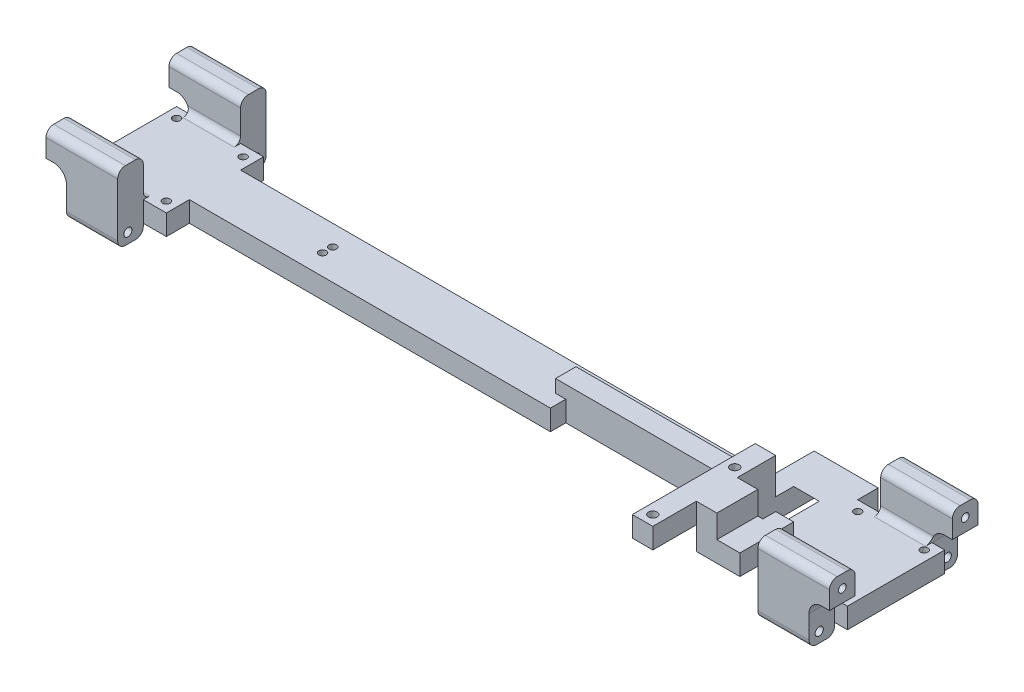
from build123d import *

# Parameters (mm, degrees)
SKETCH1_W                 = 300
SKETCH1_H                 = 20
BOSS_EXTRUDE1_DEPTH       = 8
SKETCH2_W                 = 34
SKETCH2_H                 = 8
BOSS_EXTRUDE2_DEPTH       = 9
SKETCH3_W                 = 34
SKETCH3_H                 = 8
BOSS_EXTRUDE3_DEPTH       = 9
SKETCH4_R                 = 1.45
CUT_EXTRUDE1_DEPTH        = 302.504560496
SKETCH5_W                 = 25
SKETCH5_H                 = 8
BOSS_EXTRUDE4_DEPTH       = 17
SKETCH6_W                 = 25
SKETCH6_H                 = 8
BOSS_EXTRUDE5_DEPTH       = 17
SKETCH12_W                = 8
SKETCH12_H                = 8
BOSS_EXTRUDE7_DEPTH       = 17
SKETCH14_W                = 20
SKETCH14_H                = 12
BOSS_EXTRUDE8_DEPTH       = 10
SKETCH15_R                = 1.6
CUT_EXTRUDE7_DEPTH        = 20
SKETCH16_W                = 20
SKETCH16_H                = 12
BOSS_EXTRUDE9_DEPTH       = 10
SKETCH17_R                = 1.6
CUT_EXTRUDE8_DEPTH        = 20
SKETCH18_W                = 20
SKETCH18_H                = 12
BOSS_EXTRUDE10_DEPTH      = 10
CUT_EXTRUDE9_START        = -20
SKETCH19_R                = 1.6
CUT_EXTRUDE9_DEPTH        = 20
SKETCH20_W                = 20
SKETCH20_H                = 12
BOSS_EXTRUDE11_DEPTH      = 10
CUT_EXTRUDE10_START       = -20
SKETCH21_R                = 1.6
CUT_EXTRUDE10_DEPTH       = 20
SKETCH22_W                = 10
SKETCH22_H                = 38
CUT_EXTRUDE11_DEPTH       = 306.057371653
SKETCH23_W                = 8
SKETCH23_H                = 18
CUT_EXTRUDE12_DEPTH       = 4
BOSS_EXTRUDE12_DEPTH      = 10
BOSS_EXTRUDE13_DEPTH      = 8
SKETCH26_W                = 8
SKETCH26_H                = 48
BOSS_EXTRUDE14_DEPTH      = 14
SKETCH27_W                = 8
SKETCH27_H                = 16
BOSS_EXTRUDE15_DEPTH      = 14
SKETCH28_W                = 8
SKETCH28_H                = 40
CUT_EXTRUDE13_DEPTH       = 14
SKETCH30_W                = 16
SKETCH30_H                = 14
BOSS_EXTRUDE16_DEPTH      = 9
SKETCH31_W                = 17
SKETCH31_H                = 8
CUT_EXTRUDE14_DEPTH       = 5
SKETCH32_W                = 16
SKETCH32_H                = 9
CUT_EXTRUDE15_DEPTH       = 9
CUT_EXTRUDE16_DEPTH       = 10
SKETCH34_W                = 7
SKETCH34_H                = 5
CUT_EXTRUDE17_DEPTH       = 5
SKETCH35_W                = 7
SKETCH35_H                = 5
BOSS_EXTRUDE17_DEPTH      = 5
SKETCH36_R                = 1.7
CUT_EXTRUDE18_DEPTH       = 306.928096127
SKETCH37_W                = 70
SKETCH37_H                = 8
BOSS_EXTRUDE18_DEPTH      = 5
SKETCH39_W                = 66
SKETCH39_H                = 6
CUT_EXTRUDE19_DEPTH       = 306.14258962
SKETCH40_W                = 20
SKETCH40_H                = 10
BOSS_EXTRUDE19_DEPTH      = 10
BOSS_EXTRUDE20_DEPTH      = 5
BOSS_EXTRUDE20_DEPTH_BACK = 5
SKETCH41_W                = 28
SKETCH41_H                = 10
SKETCH42_R                = 1.5
CUT_EXTRUDE20_DEPTH       = 15
SKETCH43_W                = 20
SKETCH43_H                = 10
BOSS_EXTRUDE21_DEPTH      = 10
BOSS_EXTRUDE22_DEPTH      = 5
BOSS_EXTRUDE22_DEPTH_BACK = 5
SKETCH44_W                = 28
SKETCH44_H                = 10
SKETCH45_R                = 1.5
CUT_EXTRUDE21_DEPTH       = 15
SKETCH46_W                = 20
SKETCH46_H                = 10
BOSS_EXTRUDE23_DEPTH      = 10
BOSS_EXTRUDE24_DEPTH      = 5
BOSS_EXTRUDE24_DEPTH_BACK = 5
SKETCH47_W                = 28
SKETCH47_H                = 10
CUT_EXTRUDE22_START       = -15
SKETCH48_R                = 1.5
CUT_EXTRUDE22_DEPTH       = 15
FILLET1_R                 = 5
FILLET2_R                 = 2.5
FILLET3_R                 = 3
FILLET4_R                 = 3
SKETCH49_R                = 1.45
CUT_EXTRUDE23_DEPTH       = 309.139578763


with BuildPart() as part:
    # Sketch1 → Boss-Extrude1 (new body)
    with BuildSketch(Plane(origin=(0, 0, 0), x_dir=(1, 0, 0), z_dir=(0, 1, 0))):
        with Locations((150, -10)):
            Rectangle(SKETCH1_W, SKETCH1_H)
    extrude(amount=BOSS_EXTRUDE1_DEPTH)

    # Sketch2 → Boss-Extrude2 (add)
    with BuildSketch(Plane.XY.offset(20)):
        with Locations((17, 4)):
            Rectangle(SKETCH2_W, SKETCH2_H)
        with Locations((283, 4)):
            Rectangle(SKETCH2_W, SKETCH2_H)
    extrude(amount=BOSS_EXTRUDE2_DEPTH)

    # Sketch3 → Boss-Extrude3 (add)
    with BuildSketch(Plane(origin=(0, 0, 0), x_dir=(-1, 0, 0), z_dir=(0, 0, -1))):
        with Locations((-17, 4)):
            Rectangle(SKETCH3_W, SKETCH3_H)
        with Locations((-283, 4)):
            Rectangle(SKETCH3_W, SKETCH3_H)
    extrude(amount=BOSS_EXTRUDE3_DEPTH)

    # Sketch4 → Cut-Extrude1 (cut, through all)
    with BuildSketch(Plane(origin=(0, 8, 0), x_dir=(1, 0, 0), z_dir=(0, 1, 0))):
        with Locations(Location((4, 5, 0), (0, 0, 270))):
            Circle(SKETCH4_R)
        with Locations(Location((30, 5, 0), (0, 0, 270))):
            Circle(SKETCH4_R)
        with Locations(Location((30, -25, 0), (0, 0, 270))):
            Circle(SKETCH4_R)
        with Locations(Location((4, -25, 0), (0, 0, 270))):
            Circle(SKETCH4_R)
        with Locations(Location((296, -25, 0), (0, 0, 270))):
            Circle(SKETCH4_R)
        with Locations(Location((296, 5, 0), (0, 0, 270))):
            Circle(SKETCH4_R)
        with Locations(Location((270, -25, 0), (0, 0, 270))):
            Circle(SKETCH4_R)
        with Locations(Location((270, 5, 0), (0, 0, 270))):
            Circle(SKETCH4_R)
    extrude(amount=-CUT_EXTRUDE1_DEPTH, mode=Mode.SUBTRACT)

    # Sketch5 → Boss-Extrude4 (add)
    with BuildSketch(Plane.XY.offset(20)):
        with Locations((253.5, 4)):
            Rectangle(SKETCH5_W, SKETCH5_H)
    extrude(amount=BOSS_EXTRUDE4_DEPTH)

    # Sketch6 → Boss-Extrude5 (add)
    with BuildSketch(Plane(origin=(0, 0, 0), x_dir=(-1, 0, 0), z_dir=(0, 0, -1))):
        with Locations((-253.5, 4)):
            Rectangle(SKETCH6_W, SKETCH6_H)
    extrude(amount=BOSS_EXTRUDE5_DEPTH)

    # Sketch12 → Boss-Extrude7 (add)
    with BuildSketch(Plane.XY.offset(37)):
        with Locations((245, 4)):
            Rectangle(SKETCH12_W, SKETCH12_H)
    extrude(amount=BOSS_EXTRUDE7_DEPTH)

    # Sketch14 → Boss-Extrude8 (add)
    with BuildSketch(Plane.XY.offset(29)):
        with Locations((285, 2)):
            Rectangle(SKETCH14_W, SKETCH14_H)
    extrude(amount=BOSS_EXTRUDE8_DEPTH)

    # Sketch15 → Cut-Extrude7 (cut)
    with BuildSketch(Plane(origin=(295, 0, 0), x_dir=(0, 0, -1), z_dir=(1, 0, 0))):
        with Locations((-35, 0)):
            Circle(SKETCH15_R)
    extrude(amount=-CUT_EXTRUDE7_DEPTH, mode=Mode.SUBTRACT)

    # Sketch16 → Boss-Extrude9 (add)
    with BuildSketch(Plane(origin=(0, 0, -9), x_dir=(-1, 0, 0), z_dir=(0, 0, -1))):
        with Locations((-285, 2)):
            Rectangle(SKETCH16_W, SKETCH16_H)
    extrude(amount=BOSS_EXTRUDE9_DEPTH)

    # Sketch17 → Cut-Extrude8 (cut)
    with BuildSketch(Plane(origin=(295, 0, 0), x_dir=(0, 0, -1), z_dir=(1, 0, 0))):
        with Locations((15, 0)):
            Circle(SKETCH17_R)
    extrude(amount=-CUT_EXTRUDE8_DEPTH, mode=Mode.SUBTRACT)

    # Sketch18 → Boss-Extrude10 (add)
    with BuildSketch(Plane(origin=(0, 0, -9), x_dir=(-1, 0, 0), z_dir=(0, 0, -1))):
        with Locations((-15, 2)):
            Rectangle(SKETCH18_W, SKETCH18_H)
    extrude(amount=BOSS_EXTRUDE10_DEPTH)

    # Sketch19 → Cut-Extrude9 (cut)
    with BuildSketch(Plane.ZY.offset(-5).offset(CUT_EXTRUDE9_START)):
        with Locations(Location((-15, 0, 0), (0, 0, 180))):
            Circle(SKETCH19_R)
    extrude(amount=CUT_EXTRUDE9_DEPTH, mode=Mode.SUBTRACT)

    # Sketch20 → Boss-Extrude11 (add)
    with BuildSketch(Plane.XY.offset(29)):
        with Locations((15, 2)):
            Rectangle(SKETCH20_W, SKETCH20_H)
    extrude(amount=BOSS_EXTRUDE11_DEPTH)

    # Sketch21 → Cut-Extrude10 (cut)
    with BuildSketch(Plane.ZY.offset(-5).offset(CUT_EXTRUDE10_START)):
        with Locations(Location((35, 0, 0), (0, 0, 180))):
            Circle(SKETCH21_R)
    extrude(amount=CUT_EXTRUDE10_DEPTH, mode=Mode.SUBTRACT)

    # Sketch22 → Cut-Extrude11 (cut, through all)
    with BuildSketch(Plane(origin=(0, 8, 0), x_dir=(1, 0, 0), z_dir=(0, 1, 0))):
        with Locations((254, -10)):
            Rectangle(SKETCH22_W, SKETCH22_H)
    extrude(amount=-CUT_EXTRUDE11_DEPTH, mode=Mode.SUBTRACT)

    # Sketch23 → Cut-Extrude12 (cut)
    with BuildSketch(Plane(origin=(0, 0, 0), x_dir=(-1, 0, 0), z_dir=(0, -1, 0))):
        with Locations((-263, -10)):
            Rectangle(SKETCH23_W, SKETCH23_H)
    extrude(amount=-CUT_EXTRUDE12_DEPTH, mode=Mode.SUBTRACT)

    # Sketch24 → Boss-Extrude12 (add)
    with BuildSketch(Plane.ZY.offset(-259)):
        Polygon((-9, 0), (-9, 8), (-1, 8), align=None)
        Polygon((29, 0), (29, 8), (21, 8), align=None)
    extrude(amount=BOSS_EXTRUDE12_DEPTH)

    # Sketch25 → Boss-Extrude13 (add)
    with BuildSketch(Plane.ZY.offset(-267)):
        Polygon((19, 0), (19, 4), (15, 4), align=None)
        Polygon((1, 4), (5, 4), (1, 0), align=None)
    extrude(amount=BOSS_EXTRUDE13_DEPTH)

    # Sketch26 → Boss-Extrude14 (add)
    with BuildSketch(Plane(origin=(0, 8, 0), x_dir=(1, 0, 0), z_dir=(0, 1, 0))):
        with Locations((245, -30)):
            Rectangle(SKETCH26_W, SKETCH26_H)
    extrude(amount=BOSS_EXTRUDE14_DEPTH)

    # Sketch27 → Boss-Extrude15 (add)
    with BuildSketch(Plane(origin=(0, 8, 0), x_dir=(1, 0, 0), z_dir=(0, 1, 0))):
        with Locations((253, -29)):
            Rectangle(SKETCH27_W, SKETCH27_H)
    extrude(amount=BOSS_EXTRUDE15_DEPTH)

    # Sketch28 → Cut-Extrude13 (cut)
    with BuildSketch(Plane.XZ):
        with Locations((245, 34)):
            Rectangle(SKETCH28_W, SKETCH28_H)
    extrude(amount=-CUT_EXTRUDE13_DEPTH, mode=Mode.SUBTRACT)

    # Sketch30 → Boss-Extrude16 (add)
    with BuildSketch(Plane(origin=(257, 0, 0), x_dir=(0, 0, -1), z_dir=(1, 0, 0))):
        with Locations((-29, 15)):
            Rectangle(SKETCH30_W, SKETCH30_H)
    extrude(amount=BOSS_EXTRUDE16_DEPTH)

    # Sketch31 → Cut-Extrude14 (cut)
    with BuildSketch(Plane(origin=(0, 0, 0), x_dir=(-1, 0, 0), z_dir=(0, -1, 0))):
        with Locations((-257.5, -33)):
            Rectangle(SKETCH31_W, SKETCH31_H)
    extrude(amount=-CUT_EXTRUDE14_DEPTH, mode=Mode.SUBTRACT)

    # Sketch32 → Cut-Extrude15 (cut)
    with BuildSketch(Plane(origin=(266, 0, 0), x_dir=(0, 0, -1), z_dir=(1, 0, 0))):
        with Locations((-29, 17.5)):
            Rectangle(SKETCH32_W, SKETCH32_H)
    extrude(amount=-CUT_EXTRUDE15_DEPTH, mode=Mode.SUBTRACT)

    # Sketch33 → Cut-Extrude16 (cut)
    with BuildSketch(Plane.ZY.offset(-249)):
        Polygon((29, 5), (24, 5), (29, 0), align=None)
    extrude(amount=-CUT_EXTRUDE16_DEPTH, mode=Mode.SUBTRACT)

    # Sketch34 → Cut-Extrude17 (cut)
    with BuildSketch(Plane.XY.offset(29)):
        with Locations((262.5, 2.5)):
            Rectangle(SKETCH34_W, SKETCH34_H)
    extrude(amount=-CUT_EXTRUDE17_DEPTH, mode=Mode.SUBTRACT)

    # Sketch35 → Boss-Extrude17 (add)
    with BuildSketch(Plane(origin=(0, 0, 21), x_dir=(-1, 0, 0), z_dir=(0, 0, -1))):
        with Locations((-262.5, 10.5)):
            Rectangle(SKETCH35_W, SKETCH35_H)
    extrude(amount=BOSS_EXTRUDE17_DEPTH)

    # Sketch36 → Cut-Extrude18 (cut, through all)
    with BuildSketch(Plane(origin=(0, 22, 0), x_dir=(1, 0, 0), z_dir=(0, 1, 0))):
        with Locations(Location((245, -50, 0), (0, 0, 270))):
            Circle(SKETCH36_R)
        with Locations(Location((245, -18, 0), (0, 0, 270))):
            Circle(SKETCH36_R)
    extrude(amount=-CUT_EXTRUDE18_DEPTH, mode=Mode.SUBTRACT)

    # Sketch37 → Boss-Extrude18 (add)
    with BuildSketch(Plane(origin=(0, 8, 0), x_dir=(1, 0, 0), z_dir=(0, 1, 0))):
        with Locations((206, -10)):
            Rectangle(SKETCH37_W, SKETCH37_H)
    extrude(amount=BOSS_EXTRUDE18_DEPTH)

    # Sketch39 → Cut-Extrude19 (cut, through all)
    with BuildSketch(Plane(origin=(0, 8, 0), x_dir=(1, 0, 0), z_dir=(0, 1, 0))):
        with Locations((208, -17)):
            Rectangle(SKETCH39_W, SKETCH39_H)
    extrude(amount=-CUT_EXTRUDE19_DEPTH, mode=Mode.SUBTRACT)

    # Sketch40 → Boss-Extrude19 (add)
    with BuildSketch(Plane(origin=(0, 8, 0), x_dir=(1, 0, 0), z_dir=(0, 1, 0))):
        with Locations((15, 14)):
            Rectangle(SKETCH40_W, SKETCH40_H)
    extrude(amount=BOSS_EXTRUDE19_DEPTH)

    # Sketch41 → Boss-Extrude20 (add, two sides: drawn at the far end of the back side and taken through both)
    with BuildSketch(Plane(origin=(0, 18, 0), x_dir=(1, 0, 0), z_dir=(0, 1, 0)).offset(-BOSS_EXTRUDE20_DEPTH_BACK)):
        with Locations((11, 14)):
            Rectangle(SKETCH41_W, SKETCH41_H)
    extrude(amount=BOSS_EXTRUDE20_DEPTH + BOSS_EXTRUDE20_DEPTH_BACK)

    # Sketch42 → Cut-Extrude20 (cut)
    with BuildSketch(Plane.ZY.offset(3)):
        with Locations((-14, 18)):
            Circle(SKETCH42_R)
    extrude(amount=-CUT_EXTRUDE20_DEPTH, mode=Mode.SUBTRACT)

    # Sketch43 → Boss-Extrude21 (add)
    with BuildSketch(Plane(origin=(0, 8, 0), x_dir=(1, 0, 0), z_dir=(0, 1, 0))):
        with Locations((15, -34)):
            Rectangle(SKETCH43_W, SKETCH43_H)
    extrude(amount=BOSS_EXTRUDE21_DEPTH)

    # Sketch44 → Boss-Extrude22 (add, two sides: drawn at the far end of the back side and taken through both)
    with BuildSketch(Plane(origin=(0, 18, 0), x_dir=(1, 0, 0), z_dir=(0, 1, 0)).offset(-BOSS_EXTRUDE22_DEPTH_BACK)):
        with Locations((11, -34)):
            Rectangle(SKETCH44_W, SKETCH44_H)
    extrude(amount=BOSS_EXTRUDE22_DEPTH + BOSS_EXTRUDE22_DEPTH_BACK)

    # Sketch45 → Cut-Extrude21 (cut)
    with BuildSketch(Plane.ZY.offset(3)):
        with Locations((34, 18)):
            Circle(SKETCH45_R)
    extrude(amount=-CUT_EXTRUDE21_DEPTH, mode=Mode.SUBTRACT)

    # Sketch46 → Boss-Extrude23 (add)
    with BuildSketch(Plane(origin=(0, 8, 0), x_dir=(1, 0, 0), z_dir=(0, 1, 0))):
        with Locations((285, 14)):
            Rectangle(SKETCH46_W, SKETCH46_H)
        with Locations((285, -34)):
            Rectangle(SKETCH46_W, SKETCH46_H)
    extrude(amount=BOSS_EXTRUDE23_DEPTH)

    # Sketch47 → Boss-Extrude24 (add, two sides: drawn at the far end of the back side and taken through both)
    with BuildSketch(Plane(origin=(0, 18, 0), x_dir=(1, 0, 0), z_dir=(0, 1, 0)).offset(-BOSS_EXTRUDE24_DEPTH_BACK)):
        with Locations((289, 14)):
            Rectangle(SKETCH47_W, SKETCH47_H)
        with Locations((289, -34)):
            Rectangle(SKETCH47_W, SKETCH47_H)
    extrude(amount=BOSS_EXTRUDE24_DEPTH + BOSS_EXTRUDE24_DEPTH_BACK)

    # Sketch48 → Cut-Extrude22 (cut)
    with BuildSketch(Plane(origin=(303, 0, 0), x_dir=(0, 0, -1), z_dir=(1, 0, 0)).offset(CUT_EXTRUDE22_START)):
        with Locations(Location((14, 18, 0), (0, 0, 180))):
            Circle(SKETCH48_R)
        with Locations(Location((-34, 18, 0), (0, 0, 180))):
            Circle(SKETCH48_R)
    extrude(amount=CUT_EXTRUDE22_DEPTH, mode=Mode.SUBTRACT)

    # Fillet1
    fillet1_edges = [part.edges().sort_by_distance(p)[0] for p in [
        (295, 13, 34),
        (295, 13, -14),
        (5, 13, 34),
        (5, 13, -14),
    ]]
    fillet(fillet1_edges, radius=FILLET1_R)

    # Fillet2
    # the kernel refuses this fillet: 2.5 mm, written as the material it adds along each edge
    with BuildSketch(Plane(origin=(-1.25, 8, -9), x_dir=(0, 1, 0), z_dir=(1, 0, 0))) as fillet2_piece_1_section:
        with BuildLine():
            CenterArc((FILLET2_R, FILLET2_R), FILLET2_R, 180, 90)
            Line((0, FILLET2_R), (0, 0))
            Line((0, 0), (FILLET2_R, 0))
        make_face()
    fillet2_piece_1 = extrude(amount=26.25, mode=Mode.PRIVATE)
    fillet2_piece_1 = fillet2_piece_1 - Plane(origin=(0, 8, -8.784630579), x_dir=(1, 0, 0), z_dir=(0, 0, -1)) * Cylinder(5, 63, mode=Mode.PRIVATE)
    add(fillet2_piece_1)
    with BuildSketch(Plane(origin=(25, 8, 29), x_dir=(0, 0, -1), z_dir=(-1, 0, 0))) as fillet2_piece_2_section:
        with BuildLine():
            CenterArc((FILLET2_R, -FILLET2_R), FILLET2_R, 90, 90)
            Line((0, -FILLET2_R), (0, 0))
            Line((0, 0), (FILLET2_R, 0))
        make_face()
    fillet2_piece_2 = extrude(amount=26.25, mode=Mode.PRIVATE)
    fillet2_piece_2 = fillet2_piece_2 - Plane(origin=(0, 8, 28.441580153), x_dir=(1, 0, 0), z_dir=(0, 0, 1)) * Cylinder(5, 63, mode=Mode.PRIVATE)
    add(fillet2_piece_2)
    with BuildSketch(Plane(origin=(301.25, 8, -9), x_dir=(0, 0, 1), z_dir=(-1, 0, 0))) as fillet2_piece_3_section:
        with BuildLine():
            CenterArc((FILLET2_R, FILLET2_R), FILLET2_R, 180, 90)
            Line((0, FILLET2_R), (0, 0))
            Line((0, 0), (FILLET2_R, 0))
        make_face()
    fillet2_piece_3 = extrude(amount=26.25, mode=Mode.PRIVATE)
    fillet2_piece_3 = fillet2_piece_3 - Plane(origin=(300, 8, -8.78460178), x_dir=(-1, 0, 0), z_dir=(0, 0, -1)) * Cylinder(5, 63, mode=Mode.PRIVATE)
    add(fillet2_piece_3)
    with BuildSketch(Plane(origin=(275, 8, 29), x_dir=(0, 0, -1), z_dir=(1, 0, 0))) as fillet2_piece_4_section:
        with BuildLine():
            CenterArc((FILLET2_R, FILLET2_R), FILLET2_R, 180, 90)
            Line((0, FILLET2_R), (0, 0))
            Line((0, 0), (FILLET2_R, 0))
        make_face()
    fillet2_piece_4 = extrude(amount=26.25, mode=Mode.PRIVATE)
    fillet2_piece_4 = fillet2_piece_4 - Plane(origin=(300, 8, 28.441580153), x_dir=(-1, 0, 0), z_dir=(0, 0, 1)) * Cylinder(5, 63, mode=Mode.PRIVATE)
    add(fillet2_piece_4)

    # Fillet3
    fillet3_edges = [part.edges().sort_by_distance(p)[0] for p in [
        (285, -4, 29),
        (285, -4, 39),
        (285, -4, -9),
        (285, -4, -19),
        (15, -4, -9),
        (15, -4, -19),
        (15, -4, 29),
        (15, -4, 39),
    ]]
    fillet(fillet3_edges, radius=FILLET3_R)

    # Fillet4
    fillet4_edges = [part.edges().sort_by_distance(p)[0] for p in [
        (11, 23, -19),
        (11, 23, -9),
        (11, 23, 39),
        (11, 23, 29),
        (289, 23, -9),
        (289, 23, -19),
        (289, 23, 39),
        (289, 23, 29),
    ]]
    fillet(fillet4_edges, radius=FILLET4_R)

    # Sketch49 → Cut-Extrude23 (cut, through all)
    with BuildSketch(Plane(origin=(0, 8, 0), x_dir=(1, 0, 0), z_dir=(0, 1, 0))):
        with Locations(Location((78, -8, 0), (0, 0, 270))):
            Circle(SKETCH49_R)
        with Locations(Location((78, -12, 0), (0, 0, 270))):
            Circle(SKETCH49_R)
    extrude(amount=-CUT_EXTRUDE23_DEPTH, mode=Mode.SUBTRACT)


solid = part.part
